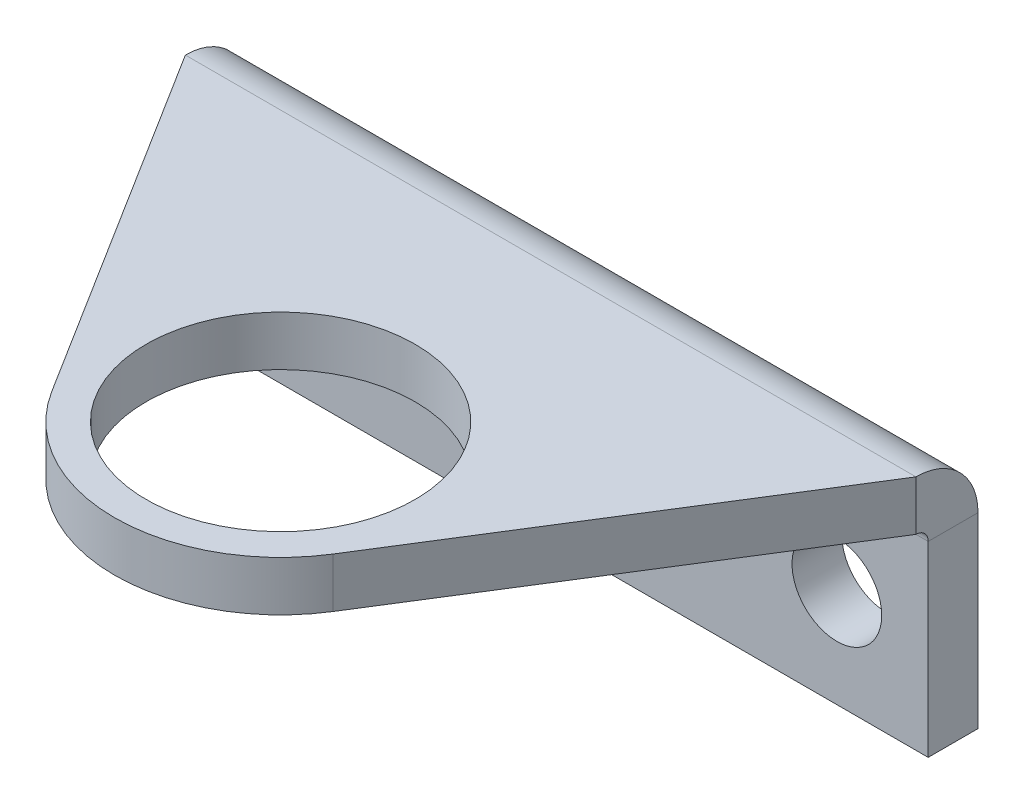
from build123d import *

# Parameters (mm, degrees)
SKETCH2_W                    = 44
SKETCH2_H                    = 12
SKETCH2_R                    = 2.7
BASE_FLANGE1_DEPTH           = 3
EDGE_FLANGE1_STRIP_W         = 13.4732
EDGE_FLANGE1_STRIP_H         = 3
EDGE_FLANGE1_STRIP_CUT_DEPTH = 44
EDGE_FLANGE1_DEPTH           = 44
CUT_EXTRUDE1_DEPTH           = 10
SKETCH11_R                   = 8.1
CUT_EXTRUDE2_DEPTH           = 10


# Sheet-metal steps are written as plain solids
with BuildPart() as part:
    # Sketch2 → Base-Flange1 (new body)
    with BuildSketch(Plane.XY):
        with Locations((22, -6)):
            Rectangle(SKETCH2_W, SKETCH2_H)
        with Locations((5.5, -6)):
            Circle(SKETCH2_R, mode=Mode.SUBTRACT)
        with Locations((38.5, -6)):
            Circle(SKETCH2_R, mode=Mode.SUBTRACT)
    extrude(amount=-BASE_FLANGE1_DEPTH)

    # Edge-Flange1 strip (across the edge) → Edge-Flange1 strip cut (cut)
    with BuildSketch(Plane(origin=(44, 0, 0), x_dir=(0, -1, 0), z_dir=(-1, 0, 0))):
        with Locations((-6, -1.5)):
            Rectangle(EDGE_FLANGE1_STRIP_W, EDGE_FLANGE1_STRIP_H)
    extrude(amount=EDGE_FLANGE1_STRIP_CUT_DEPTH, mode=Mode.SUBTRACT)

    # Edge-Flange1 section (across the edge) → Edge-Flange1 (add)
    with BuildSketch(Plane(origin=(44, 0, 0), x_dir=(0, -1, 0), z_dir=(-1, 0, 0))):
        with BuildLine():
            Line((-3, 0.7366), (-3, 29.1))
            Line((-3, 29.1), (0, 29.1))
            Line((0, 29.1), (0, 0.7366))
            ThreePointArc((0, 0.7366), (0.215745145, 0.215745145), (0.7366, 0))
            Line((0.7366, 0), (0.7366, -3))
            ThreePointArc((0.7366, -3), (-1.905575199, -1.905575199), (-3, 0.7366))
        make_face()
    extrude(amount=EDGE_FLANGE1_DEPTH)

    # Sketch10 → Cut-Extrude1 (cut)
    with BuildSketch(Plane.XZ):
        with BuildLine():
            Line((0, 0.7366), (13.527598835, 22.312101137))
            ThreePointArc((13.527598835, 22.312101137), (22, 27), (30.472401165, 22.312101137))
            Line((30.472401165, 22.312101137), (44, 0.7366))
            Line((44, 0.7366), (48.421398218, 0.7366))
            Line((48.421398218, 0.7366), (48.421398218, 35.108579441))
            Line((48.421398218, 35.108579441), (-4.285342107, 35.108579441))
            Line((-4.285342107, 35.108579441), (-4.285342107, 0.7366))
            Line((-4.285342107, 0.7366), (0, 0.7366))
        make_face()
    extrude(amount=-CUT_EXTRUDE1_DEPTH, mode=Mode.SUBTRACT)

    # Sketch11 → Cut-Extrude2 (cut)
    with BuildSketch(Plane.XZ):
        with Locations(Location((22, 17, 0), (0, 0, 270))):
            Circle(SKETCH11_R)
    extrude(amount=-CUT_EXTRUDE2_DEPTH, mode=Mode.SUBTRACT)


solid = part.part
